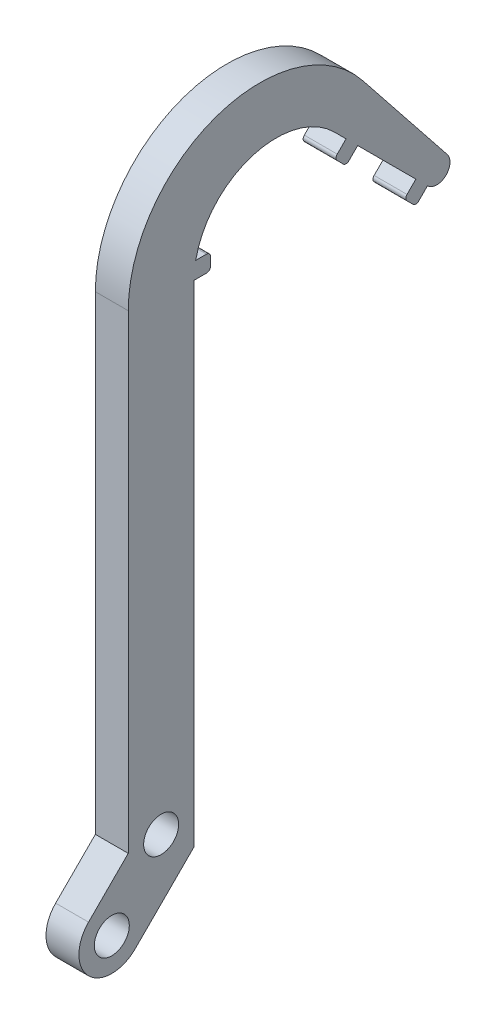
from build123d import *

# Parameters (mm, degrees)
BOSS_EXTRUDE1_DEPTH         = 6.35
F_1_4_CLEARANCE_HOLE1_D     = 6.7564
F_1_4_CLEARANCE_HOLE1_DEPTH = 8.382
F_1_4_CLEARANCE_HOLE1_TIP   = 2.029827343
BOSS_EXTRUDE2_DEPTH         = 6.35
CRVPATTERN2_START           = 12.7
CRVPATTERN2_OUTLINE_W       = 6.35
CRVPATTERN2_OUTLINE_H       = 3.175
CRVPATTERN2_DEPTH           = 3.175
SKETCH5_W                   = 3.175
SKETCH5_H                   = 3.175
BOSS_EXTRUDE3_DEPTH         = 6.35
FILLET1_R                   = 0.762


# Read off the part's stored shape, not the designer's step: CrvPattern2
with BuildPart() as part:
    # Sketch1 → Boss-Extrude1 (new body)
    with BuildSketch(Plane(origin=(0, 0, 0), x_dir=(0, 0, -1), z_dir=(1, 0, 0))):
        with BuildLine():
            Line((-28.575, -89.444743879), (-28.575, 1.27))
            ThreePointArc((-28.575, 1.27), (-11.551976139, 25.24887134), (16.699509509, 17.086569533))
            Line((16.699509509, 17.086569533), (32.969334569, -3.357483913))
            ThreePointArc((32.969334569, -3.357483913), (32.673446977, -6.833926713), (29.185832393, -6.735192091))
            Line((29.185832393, -6.735192091), (11.225320151, 11.225320151))
            ThreePointArc((11.225320151, 11.225320151), (-6.075099489, 14.666587579), (-15.875, 0))
            Line((-15.875, 0), (-15.875, -94.705256121))
            Line((-15.875, -94.705256121), (-27.259871939, -106.090128061))
            ThreePointArc((-27.259871939, -106.090128061), (-36.240128061, -106.090128061), (-36.240128061, -97.109871939))
            Line((-36.240128061, -97.109871939), (-28.575, -89.444743879))
        make_face()
    extrude(amount=BOSS_EXTRUDE1_DEPTH)

    # 1/4 Clearance Hole1
    with Locations(Plane(origin=(6.35, 0, 0), x_dir=(0, 0, -1), z_dir=(1, 0, 0))):
        with Locations((-22.225, -89.444743879), (-31.75, -101.6)):
            Hole(F_1_4_CLEARANCE_HOLE1_D / 2, depth=F_1_4_CLEARANCE_HOLE1_DEPTH)
            with Locations((0, 0, -(F_1_4_CLEARANCE_HOLE1_DEPTH + F_1_4_CLEARANCE_HOLE1_TIP / 2))):  # 118° drill point
                Cone(0, F_1_4_CLEARANCE_HOLE1_D / 2, F_1_4_CLEARANCE_HOLE1_TIP, mode=Mode.SUBTRACT)

    # Sketch4 → Boss-Extrude2 (add)
    with BuildSketch(Plane(origin=(6.35, 0, 0), x_dir=(0, 0, -1), z_dir=(1, 0, 0))):
        Polygon((29.185832393, -6.735192091), (26.940768363, -8.980256121), (24.695704333, -6.735192091), (26.940768363, -4.490128061), align=None)
    extrude(amount=-BOSS_EXTRUDE2_DEPTH)

    # CrvPattern2 outline → CrvPattern2 (add)
    with BuildSketch(Plane(origin=(0, 0, 0), x_dir=(1, 0, 0), z_dir=(0, 0.7071067811865476, -0.7071067811865476)).offset(CRVPATTERN2_START)):
        with Locations((3.175, 4.7625)):
            Rectangle(CRVPATTERN2_OUTLINE_W, CRVPATTERN2_OUTLINE_H)
    extrude(amount=CRVPATTERN2_DEPTH)

    # Sketch5 → Boss-Extrude3 (add)
    with BuildSketch(Plane(origin=(6.35, 0, 0), x_dir=(0, 0, -1), z_dir=(1, 0, 0))):
        with Locations((-14.2875, 1.5875)):
            Rectangle(SKETCH5_W, SKETCH5_H)
    extrude(amount=-BOSS_EXTRUDE3_DEPTH)

    # Fillet1
    fillet1_edges = [part.edges().sort_by_distance(p)[0] for p in [
        (3.175, 4.490128061, -13.470384182),
        (3.175, 6.735192091, -11.225320151),
        (3.175, 3.175, 12.7),
        (3.175, 0, 12.7),
        (3.175, -8.980256121, -26.940768363),
        (3.175, -6.735192091, -24.695704333),
    ]]
    fillet(fillet1_edges, radius=FILLET1_R)


solid = part.part
